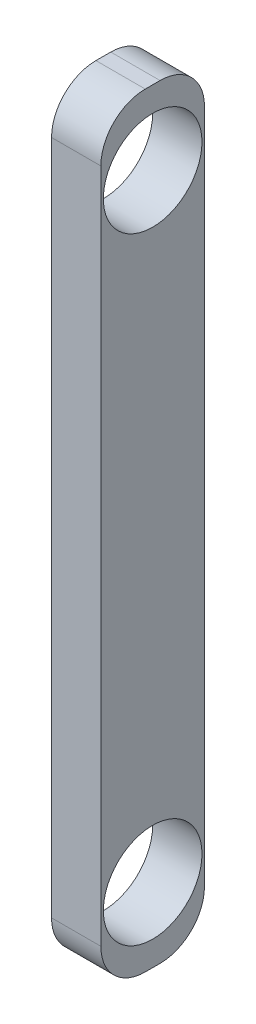
from build123d import *

# Parameters (mm, degrees)
SKETCH1_W           = 4.2
SKETCH1_H           = 31
SKETCH1_R           = 2
BOSS_EXTRUDE1_DEPTH = 2
FILLET1_R           = 1.8


with BuildPart() as part:
    # Sketch1 → Boss-Extrude1 (new body)
    with BuildSketch(Plane(origin=(0, 0, 0), x_dir=(0, 0, -1), z_dir=(1, 0, 0))):
        with Locations((0, 15.5)):
            Rectangle(SKETCH1_W, SKETCH1_H)
        with Locations((0, 28)):
            Circle(SKETCH1_R, mode=Mode.SUBTRACT)
        with Locations((0, 3)):
            Circle(SKETCH1_R, mode=Mode.SUBTRACT)
    extrude(amount=BOSS_EXTRUDE1_DEPTH)

    # Fillet1
    fillet1_edges = [part.edges().sort_by_distance(p)[0] for p in [
        (1, 0, 2.1),
        (1, 0, -2.1),
        (1, 31, 2.1),
        (1, 31, -2.1),
    ]]
    fillet(fillet1_edges, radius=FILLET1_R)


solid = part.part
